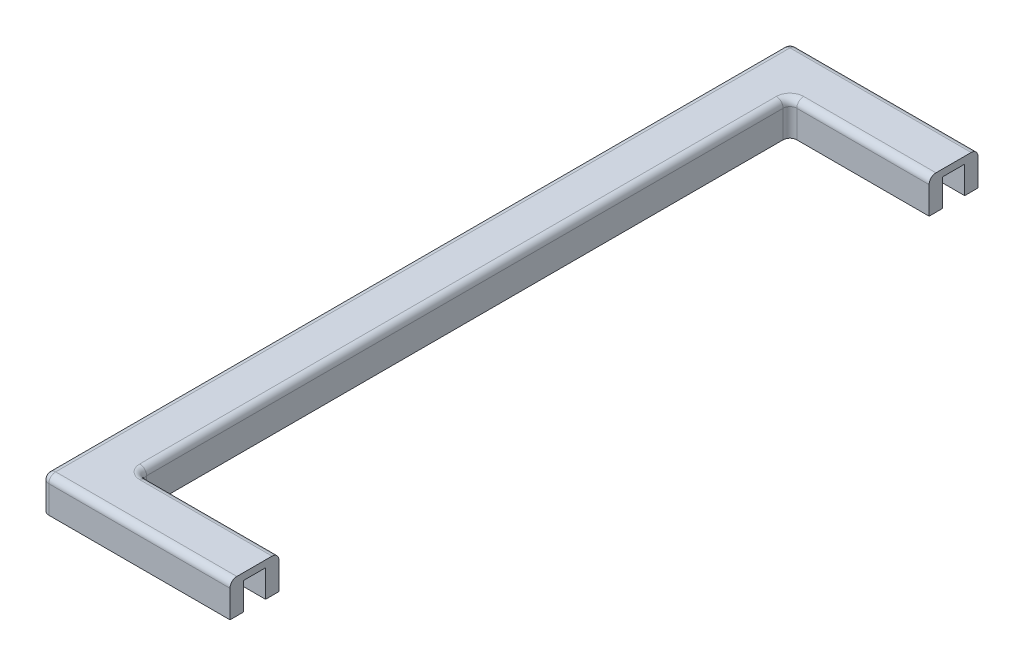
from build123d import *

# Parameters (mm, degrees)
SKETCH1_W               = 247.35
SKETCH1_H               = 198
SKETCH1_W_2             = 239.55
SKETCH1_H_2             = 190.2
BOSS_EXTRUDE1_DEPTH     = 8
SKETCH1_W_3             = 268.15
SKETCH1_H_3             = 218.8
SKETCH1_W_4             = 260.35
SKETCH1_H_4             = 211
BOSS_EXTRUDE1_2_DEPTH   = 8
SKETCH3_W               = 268.15
SKETCH3_H               = 218.8
SKETCH3_W_2             = 239.55
SKETCH3_H_2             = 190.2
BOSS_EXTRUDE2_DEPTH     = 2
FILLET1_R               = 2
CUT_EXTRUDE2_DEPTH      = 174.333394431
CUT_EXTRUDE2_DEPTH_BACK = 174.333394431
SKETCH5_W               = 300
SKETCH5_H               = 300


with BuildPart() as part:
    # Sketch1 → Boss-Extrude1 (new body)
    with BuildSketch(Plane(origin=(0, 0, 0), x_dir=(1, 0, 0), z_dir=(0, 1, 0))):
        Rectangle(SKETCH1_W, SKETCH1_H)
        Rectangle(SKETCH1_W_2, SKETCH1_H_2, mode=Mode.SUBTRACT)
    extrude(amount=BOSS_EXTRUDE1_DEPTH)



with BuildPart() as body_2:
    # Sketch1 → Boss-Extrude1 2 (new body)
    with BuildSketch(Plane(origin=(0, 0, 0), x_dir=(1, 0, 0), z_dir=(0, 1, 0))):
        Rectangle(SKETCH1_W_3, SKETCH1_H_3)
        Rectangle(SKETCH1_W_4, SKETCH1_H_4, mode=Mode.SUBTRACT)
    extrude(amount=BOSS_EXTRUDE1_2_DEPTH)


with BuildPart() as part_1:
    add(part.part)

    add(body_2.part)  # Boss-Extrude2 merges body 2
    # Sketch3 → Boss-Extrude2 (add)
    with BuildSketch(Plane(origin=(0, 8, 0), x_dir=(1, 0, 0), z_dir=(0, 1, 0))):
        Rectangle(SKETCH3_W, SKETCH3_H)
        Rectangle(SKETCH3_W_2, SKETCH3_H_2, mode=Mode.SUBTRACT)
    extrude(amount=BOSS_EXTRUDE2_DEPTH)

    # Fillet1
    fillet1_edges = [part_1.edges().sort_by_distance(p)[0] for p in [
        (-119.775, 5, 95.1),
        (-119.775, 5, -95.1),
        (119.775, 5, -95.1),
        (119.775, 5, 95.1),
        (-134.075, 5, -109.4),
        (-134.075, 5, 109.4),
        (134.075, 5, -109.4),
        (134.075, 5, 109.4),
        (0, 10, 95.1),
        (-119.775, 10, 0),
        (0, 10, -95.1),
        (119.775, 10, 0),
        (134.075, 10, 0),
        (0, 10, -109.4),
        (-134.075, 10, 0),
        (0, 10, 109.4),
    ]]
    fillet(fillet1_edges, radius=FILLET1_R)

    # Sketch5 → Cut-Extrude2 (cut, two sides: drawn at the far end of the back side and taken through both)
    with BuildSketch(Plane(origin=(0, 10, 0), x_dir=(1, 0, 0), z_dir=(0, 1, 0)).offset(-CUT_EXTRUDE2_DEPTH_BACK)):
        with Locations((70.925, 0)):
            Rectangle(SKETCH5_W, SKETCH5_H)
    extrude(amount=CUT_EXTRUDE2_DEPTH + CUT_EXTRUDE2_DEPTH_BACK, mode=Mode.SUBTRACT)


solid = part_1.part
